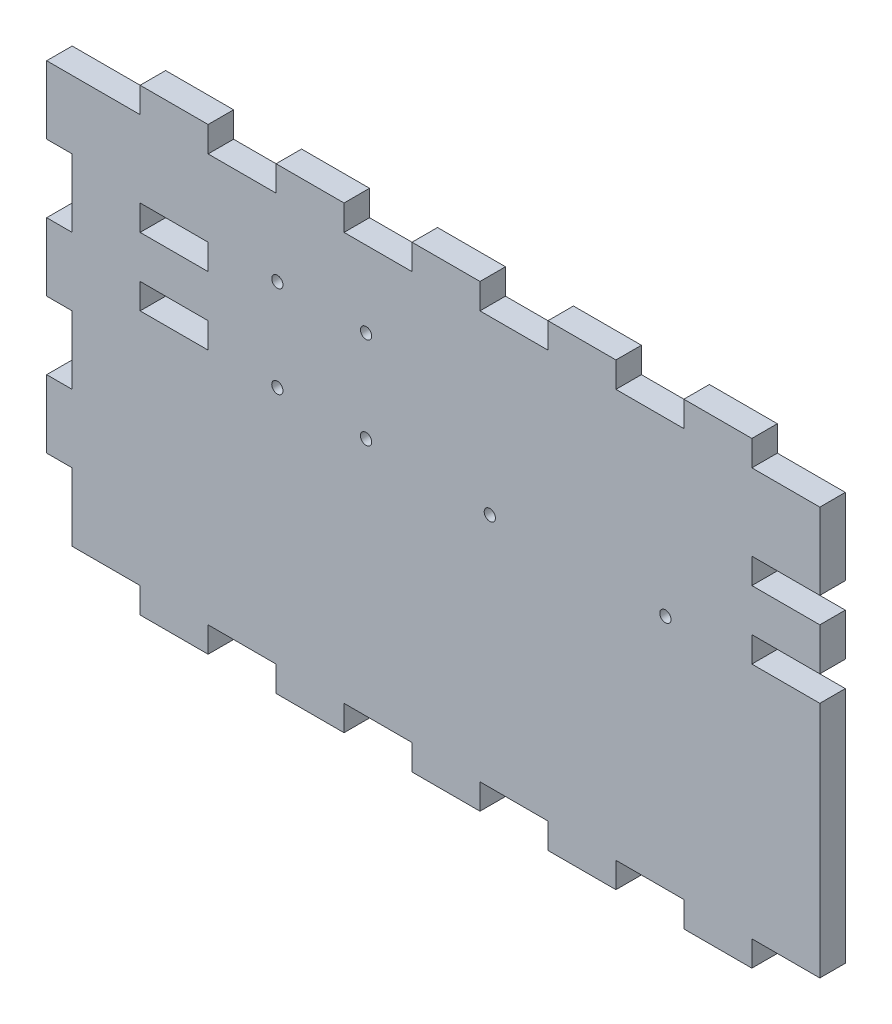
from build123d import *

# Parameters (mm, degrees)
SKETCH1_W               = 279.4
SKETCH1_H               = 152.4
BOSS_EXTRUDE1_DEPTH     = 9.525
SKETCH2_W               = 25.4
SKETCH2_H               = 9.525
BOSS_EXTRUDE2_DEPTH     = 9.525
LPATTERN1_COUNT         = 5
LPATTERN1_PITCH         = 50.8
MIRROR1_COPY_1_SKETCH_W = 25.4
MIRROR1_COPY_1_SKETCH_H = 9.525
MIRROR1_COPY_1_DEPTH    = 9.525
MIRROR1_COPY_2_SKETCH_W = 25.4
MIRROR1_COPY_2_SKETCH_H = 9.525
MIRROR1_COPY_2_DEPTH    = 9.525
MIRROR1_COPY_3_SKETCH_W = 25.4
MIRROR1_COPY_3_SKETCH_H = 9.525
MIRROR1_COPY_3_DEPTH    = 9.525
MIRROR1_COPY_4_SKETCH_W = 25.4
MIRROR1_COPY_4_SKETCH_H = 9.525
MIRROR1_COPY_4_DEPTH    = 9.525
MIRROR1_COPY_5_SKETCH_W = 25.4
MIRROR1_COPY_5_SKETCH_H = 9.525
MIRROR1_COPY_5_DEPTH    = 9.525
SKETCH3_W               = 9.525
SKETCH3_H               = 25.4
BOSS_EXTRUDE3_DEPTH     = 9.525
LPATTERN2_COUNT         = 3
LPATTERN2_PITCH         = 50.8
SKETCH4_W               = 25.4
SKETCH4_H               = 9.525
CUT_EXTRUDE1_DEPTH      = 173.358933261
LPATTERN3_COUNT         = 2
LPATTERN3_PITCH         = 228.6
SKETCH5_W               = 25.4
SKETCH5_H               = 9.525
CUT_EXTRUDE2_DEPTH      = 173.358933261
LPATTERN4_COUNT         = 2
LPATTERN4_PITCH         = 228.6
SKETCH6_R               = 2.1
CUT_EXTRUDE3_DEPTH      = 173.358933261


with BuildPart() as part:
    # Sketch1 → Boss-Extrude1 (new body)
    with BuildSketch(Plane.XY):
        Rectangle(SKETCH1_W, SKETCH1_H)
    extrude(amount=BOSS_EXTRUDE1_DEPTH)

    # Sketch2 → Boss-Extrude2 (add)
    with BuildSketch(Plane.XZ.offset(76.2)):
        with Locations((-101.6, 4.7625)):
            Rectangle(SKETCH2_W, SKETCH2_H)
    boss_extrude2 = extrude(amount=BOSS_EXTRUDE2_DEPTH)

    # LPattern1: Boss-Extrude2 ×5
    with Locations(*[(i * LPATTERN1_PITCH, 0, 0) for i in range(1, LPATTERN1_COUNT)]):
        add(boss_extrude2)

    # Mirror1 copy 1 sketch → Mirror1 copy 1 (add)
    with BuildSketch(Plane(origin=(50.8, 76.2, 0), x_dir=(1, 0, 0), z_dir=(0, 1, 0))):
        with Locations((-101.6, -4.7625)):
            Rectangle(MIRROR1_COPY_1_SKETCH_W, MIRROR1_COPY_1_SKETCH_H)
    extrude(amount=MIRROR1_COPY_1_DEPTH)

    # Mirror1 copy 2 sketch → Mirror1 copy 2 (add)
    with BuildSketch(Plane(origin=(101.6, 76.2, 0), x_dir=(1, 0, 0), z_dir=(0, 1, 0))):
        with Locations((-101.6, -4.7625)):
            Rectangle(MIRROR1_COPY_2_SKETCH_W, MIRROR1_COPY_2_SKETCH_H)
    extrude(amount=MIRROR1_COPY_2_DEPTH)

    # Mirror1 copy 3 sketch → Mirror1 copy 3 (add)
    with BuildSketch(Plane(origin=(152.4, 76.2, 0), x_dir=(1, 0, 0), z_dir=(0, 1, 0))):
        with Locations((-101.6, -4.7625)):
            Rectangle(MIRROR1_COPY_3_SKETCH_W, MIRROR1_COPY_3_SKETCH_H)
    extrude(amount=MIRROR1_COPY_3_DEPTH)

    # Mirror1 copy 4 sketch → Mirror1 copy 4 (add)
    with BuildSketch(Plane(origin=(203.2, 76.2, 0), x_dir=(1, 0, 0), z_dir=(0, 1, 0))):
        with Locations((-101.6, -4.7625)):
            Rectangle(MIRROR1_COPY_4_SKETCH_W, MIRROR1_COPY_4_SKETCH_H)
    extrude(amount=MIRROR1_COPY_4_DEPTH)

    # Mirror1 copy 5 sketch → Mirror1 copy 5 (add)
    with BuildSketch(Plane(origin=(0, 76.2, 0), x_dir=(1, 0, 0), z_dir=(0, 1, 0))):
        with Locations((-101.6, -4.7625)):
            Rectangle(MIRROR1_COPY_5_SKETCH_W, MIRROR1_COPY_5_SKETCH_H)
    extrude(amount=MIRROR1_COPY_5_DEPTH)

    # Sketch3 → Boss-Extrude3 (add)
    with BuildSketch(Plane.ZY.offset(139.7)):
        with Locations((4.7625, 63.5)):
            Rectangle(SKETCH3_W, SKETCH3_H)
    boss_extrude3 = extrude(amount=BOSS_EXTRUDE3_DEPTH)

    # LPattern2: Boss-Extrude3 ×3
    with Locations(*[(0, -i * LPATTERN2_PITCH, 0) for i in range(1, LPATTERN2_COUNT)]):
        add(boss_extrude3)

    # Sketch4 → Cut-Extrude1 (cut, through all)
    with BuildSketch(Plane(origin=(0, 0, 0), x_dir=(-1, 0, 0), z_dir=(0, 0, -1))):
        with Locations((-127, 17.4625)):
            Rectangle(SKETCH4_W, SKETCH4_H)
    cut_extrude1 = extrude(amount=-CUT_EXTRUDE1_DEPTH, mode=Mode.SUBTRACT)

    # LPattern3: Cut-Extrude1 ×2
    with Locations(*[(-i * LPATTERN3_PITCH, 0, 0) for i in range(1, LPATTERN3_COUNT)]):
        add(cut_extrude1, mode=Mode.SUBTRACT)

    # Sketch5 → Cut-Extrude2 (cut, through all)
    with BuildSketch(Plane.XY.offset(9.525)):
        with Locations((-101.6, 42.8625)):
            Rectangle(SKETCH5_W, SKETCH5_H)
    cut_extrude2 = extrude(amount=-CUT_EXTRUDE2_DEPTH, mode=Mode.SUBTRACT)

    # LPattern4: Cut-Extrude2 ×2
    with Locations(*[(i * LPATTERN4_PITCH, 0, 0) for i in range(1, LPATTERN4_COUNT)]):
        add(cut_extrude2, mode=Mode.SUBTRACT)

    # Sketch6 → Cut-Extrude3 (cut, through all)
    with BuildSketch(Plane(origin=(0, 0, 0), x_dir=(-1, 0, 0), z_dir=(0, 0, -1))):
        with Locations((-81.986081859, 12)):
            Circle(SKETCH6_R)
        with Locations((-16.378881859, 12)):
            Circle(SKETCH6_R)
        with Locations((63.020004141, 13.50877)):
            Circle(SKETCH6_R)
        with Locations((29.870004141, 47.77)):
            Circle(SKETCH6_R)
        with Locations((63.020004141, 47.77)):
            Circle(SKETCH6_R)
        with Locations((29.870004141, 13.50877)):
            Circle(SKETCH6_R)
    extrude(amount=-CUT_EXTRUDE3_DEPTH, mode=Mode.SUBTRACT)


solid = part.part
